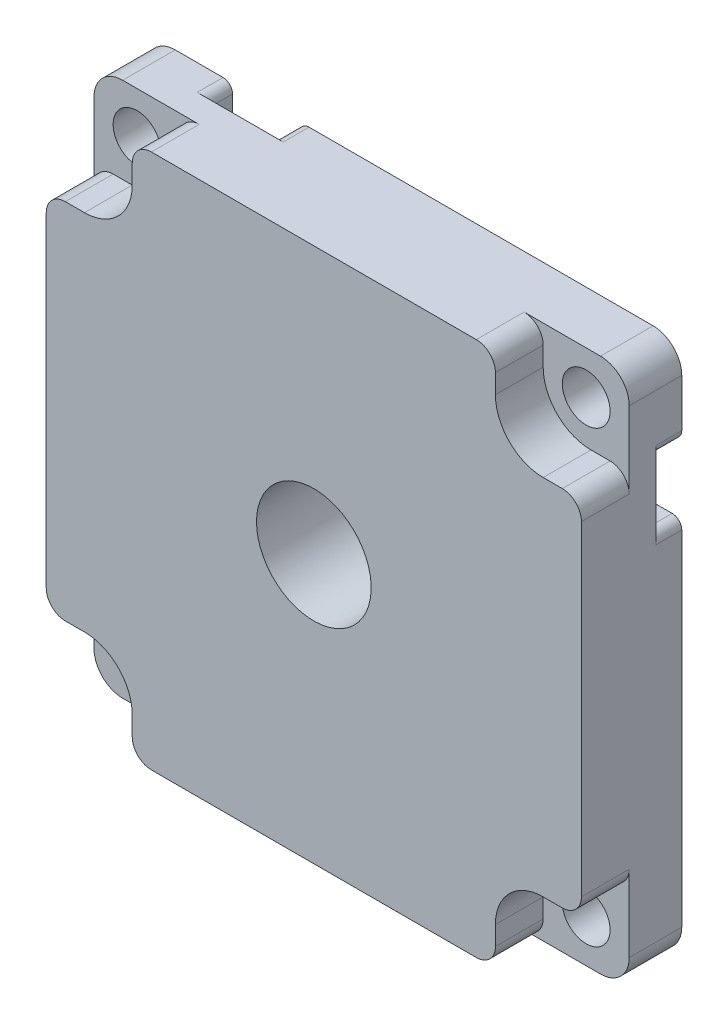
from build123d import *

# Parameters (mm, degrees)
SKETCH1_W           = 56
SKETCH1_H           = 56
BOSS_EXTRUDE1_DEPTH = 10.5
SKETCH4_R           = 19
BOSS_EXTRUDE4_DEPTH = 1.5
FILLET1_R           = 0.5
FILLET2_R           = 3
SKETCH5_R           = 6
CUT_EXTRUDE1_DEPTH  = 42.376321731
SKETCH8_W           = 7
SKETCH8_H           = 6
CUT_EXTRUDE2_DEPTH  = 2.7
CIRPATTERN7_COUNT   = 4
FILLET5_R           = 1
FILLET6_R           = 3.5
SKETCH10_W          = 9
SKETCH10_H          = 9
CUT_EXTRUDE4_DEPTH  = 5
CIRPATTERN11_COUNT  = 4
FILLET8_R           = 2
FILLET9_R           = 5
CIRPATTERN12_COUNT  = 4


with BuildPart() as part:
    # Sketch1 → Boss-Extrude1 (new body)
    with BuildSketch(Plane.XY):
        Rectangle(SKETCH1_W, SKETCH1_H)
    extrude(amount=BOSS_EXTRUDE1_DEPTH)

    # Sketch4 → Boss-Extrude4 (add)
    with BuildSketch(Plane(origin=(0, 0, 0), x_dir=(-1, 0, 0), z_dir=(0, 0, -1))):
        with Locations(Location((0, 0, 0), (0, 0, 180))):
            Circle(SKETCH4_R)
    extrude(amount=BOSS_EXTRUDE4_DEPTH)

    # Fillet1
    fillet1_edges = [part.edges().sort_by_distance(p)[0] for p in [
        (-19, 0, 0),
    ]]
    fillet(fillet1_edges, radius=FILLET1_R)

    # Fillet2
    fillet2_edges = [part.edges().sort_by_distance(p)[0] for p in [
        (-28, 28, 5.25),
        (28, 28, 5.25),
        (28, -28, 5.25),
        (-28, -28, 5.25),
    ]]
    fillet(fillet2_edges, radius=FILLET2_R)

    # Sketch5 → Cut-Extrude1 (cut, through all)
    with BuildSketch(Plane(origin=(0, 0, -1.5), x_dir=(-1, 0, 0), z_dir=(0, 0, -1))):
        Circle(SKETCH5_R)
    extrude(amount=-CUT_EXTRUDE1_DEPTH, mode=Mode.SUBTRACT)

    # Sketch7 → Ø5.0mm Dowel Hole1 (revolve, cut)
    with BuildSketch(Plane(origin=(23.5, 23.5, 0), x_dir=(0, 1, 0), z_dir=(1, 0, 0))):
        Polygon((0, 0), (0, 18.502151548), (2.5, 17), (2.5, 0), align=None)
    f_5_0mm_dowel_hole1 = revolve(axis=Axis((23.5, 23.5, -6.35), (0, 0, 1)), mode=Mode.SUBTRACT)

    # Sketch8 → Cut-Extrude2 (cut)
    with BuildSketch(Plane(origin=(0, 0, 0), x_dir=(-1, 0, 0), z_dir=(0, 0, -1))):
        with Locations((15.5, 25)):
            Rectangle(SKETCH8_W, SKETCH8_H)
    cut_extrude2 = extrude(amount=-CUT_EXTRUDE2_DEPTH, mode=Mode.SUBTRACT)

    # CirPattern7: Cut-Extrude2 ×4 about axis
    cirpattern7_axis = Axis((0, 0, 0), (0, 0, 1))
    for i in range(1, CIRPATTERN7_COUNT):
        add(cut_extrude2.rotate(cirpattern7_axis, i * 360 / CIRPATTERN7_COUNT), mode=Mode.SUBTRACT)

    # Fillet5
    fillet5_edges = [part.edges().sort_by_distance(p)[0] for p in [
        (-28, -12, 1.35),
        (-28, -19, 1.35),
        (-12, 28, 1.35),
        (-19, 28, 1.35),
        (28, 12, 1.35),
        (28, 19, 1.35),
        (12, -28, 1.35),
        (19, -28, 1.35),
    ]]
    fillet(fillet5_edges, radius=FILLET5_R)

    # Fillet6
    fillet6_edges = [part.edges().sort_by_distance(p)[0] for p in [
        (-12, 22, 1.35),
        (-19, 22, 1.35),
        (22, 12, 1.35),
        (22, 19, 1.35),
        (12, -22, 1.35),
        (19, -22, 1.35),
        (-22, -19, 1.35),
        (-22, -12, 1.35),
    ]]
    fillet(fillet6_edges, radius=FILLET6_R - 0.0001)  # a hair under: the kernel refuses the full size

    # Sketch10 → Cut-Extrude4 (cut)
    with BuildSketch(Plane.XY.offset(10.5)):
        with Locations((-23.5, 23.5)):
            Rectangle(SKETCH10_W, SKETCH10_H)
    cut_extrude4 = extrude(amount=-CUT_EXTRUDE4_DEPTH, mode=Mode.SUBTRACT)

    # CirPattern11: Cut-Extrude4 ×4 about axis
    cirpattern11_axis = Axis((0, 0, 0), (0, 0, 1))
    for i in range(1, CIRPATTERN11_COUNT):
        add(cut_extrude4.rotate(cirpattern11_axis, i * 360 / CIRPATTERN11_COUNT), mode=Mode.SUBTRACT)

    # Fillet8
    fillet8_edges = [part.edges().sort_by_distance(p)[0] for p in [
        (-28, 19, 8),
        (-19, 28, 8),
        (19, 28, 8),
        (28, 19, 8),
        (28, -19, 8),
        (19, -28, 8),
        (-19, -28, 8),
        (-28, -19, 8),
    ]]
    fillet(fillet8_edges, radius=FILLET8_R)

    # Fillet9
    fillet9_edges = [part.edges().sort_by_distance(p)[0] for p in [
        (-19, 19, 8),
        (19, 19, 8),
        (19, -19, 8),
        (-19, -19, 8),
    ]]
    fillet(fillet9_edges, radius=FILLET9_R)

    # CirPattern12: Ø5.0mm Dowel Hole1 ×4 about axis
    cirpattern12_axis = Axis((0, 0, 0), (0, 0, 1))
    for i in range(1, CIRPATTERN12_COUNT):
        add(f_5_0mm_dowel_hole1.rotate(cirpattern12_axis, i * 360 / CIRPATTERN12_COUNT), mode=Mode.SUBTRACT)


solid = part.part
